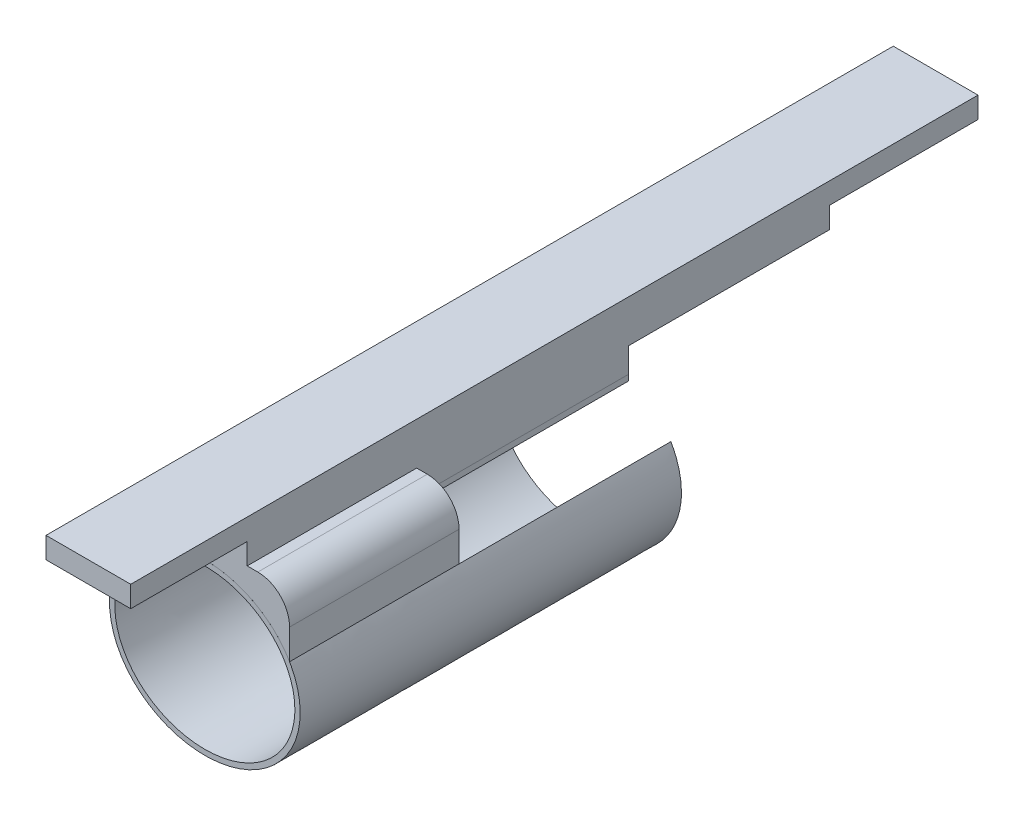
from build123d import *

# Parameters (mm, degrees)
SKETCH1_RX          = 0.9
SKETCH1_RY          = 0.8
BOSS_EXTRUDE1_DEPTH = 3.6
CUT_EXTRUDE2_REACH  = 5.796
SKETCH2_RX          = 0.85
SKETCH2_RY          = 0.75
BOSS_EXTRUDE3_DEPTH = 3.6
SKETCH3_W           = 0.8
SKETCH3_H           = 5.5
BOSS_EXTRUDE4_DEPTH = 0.2
SKETCH4_W           = 0.8
SKETCH4_H           = 8
BOSS_EXTRUDE5_DEPTH = 0.2
FILLET2_R           = 0.3
CUT_EXTRUDE4_START  = -0.696564
SKETCH5_W           = 0.4
SKETCH5_H           = 2
CUT_EXTRUDE4_DEPTH  = 0.696564


# Read off the part's stored shape, not the designer's step: Boss-Extrude3
with BuildPart() as part:
    # Sketch1 → Boss-Extrude1 (new body)
    with BuildSketch(Plane.XY):
        with Locations((0, 0)):
            Ellipse(SKETCH1_RX, SKETCH1_RY)
    extrude(amount=BOSS_EXTRUDE1_DEPTH)

    # Sketch2 → Cut-Extrude2 (cut, up to next)
    with BuildSketch(Plane.XY.offset(3.6), mode=Mode.PRIVATE) as cut_extrude2_sk1:
        with Locations((0, 0)):
            Ellipse(SKETCH2_RX, SKETCH2_RY)
    cut_extrude2_tool1 = extrude(cut_extrude2_sk1.sketch, amount=-CUT_EXTRUDE2_REACH, mode=Mode.PRIVATE) & part.part
    add(cut_extrude2_tool1.solids().sort_by_distance((0, 0, 3.6))[0], mode=Mode.SUBTRACT)


with BuildPart() as body_2:
    # Boss-Extrude3 outline → Boss-Extrude3 (new body)
    with BuildSketch(Plane.XY):
        with BuildLine():
            Line((0.8, 0.366498278), (0.8, 0.95))
            Line((0.8, 0.95), (-0.8, 0.95))
            Line((-0.8, 0.95), (-0.8, 0.366498278))
            add(Edge.make_bspline(
                [(0.8, 0.366498278), (0, 1.7462565), (-0.8, 0.366498278)],
                knots=[0.47588225, 0.47588225, 0.47588225, 2.665710404, 2.665710404, 2.665710404], degree=2, weights=[1, 0.458122847, 1]))
        make_face()
    extrude(amount=BOSS_EXTRUDE3_DEPTH)

    # Sketch3 → Boss-Extrude4 (add)
    with BuildSketch(Plane(origin=(0, 0.95, 0), x_dir=(1, 0, 0), z_dir=(0, 1, 0))):
        with Locations((0, -0.85)):
            Rectangle(SKETCH3_W, SKETCH3_H)
    extrude(amount=BOSS_EXTRUDE4_DEPTH)

    # Sketch4 → Boss-Extrude5 (add)
    with BuildSketch(Plane(origin=(0, 1.15, 0), x_dir=(1, 0, 0), z_dir=(0, 1, 0))):
        with Locations((0, -0.7)):
            Rectangle(SKETCH4_W, SKETCH4_H)
    extrude(amount=BOSS_EXTRUDE5_DEPTH)

    # Fillet2
    fillet2_edges = [body_2.edges().sort_by_distance(p)[0] for p in [
        (0.8, 0.95, 1.8),
        (-0.8, 0.95, 1.8),
    ]]
    fillet(fillet2_edges, radius=FILLET2_R)


with BuildPart() as cut_extrude4_tool:
    # Sketch5 → Cut-Extrude4 (new body)
    with BuildSketch(Plane(origin=(0, 0.95, 0), x_dir=(1, 0, 0), z_dir=(0, 1, 0)).offset(CUT_EXTRUDE4_START)):
        with Locations((-0.6, -1)):
            Rectangle(SKETCH5_W, SKETCH5_H)
        with Locations((0.6, -1)):
            Rectangle(SKETCH5_W, SKETCH5_H)
    extrude(amount=CUT_EXTRUDE4_DEPTH)


with BuildPart() as part_1:
    add(part.part)

    # Cut-Extrude4: cut by cut_extrude4_tool
    add(cut_extrude4_tool.part, mode=Mode.SUBTRACT)


with BuildPart() as body_2_1:
    add(body_2.part)

    # Cut-Extrude4: cut by cut_extrude4_tool
    add(cut_extrude4_tool.part, mode=Mode.SUBTRACT)


solid = Compound([part_1.part, body_2_1.part])
